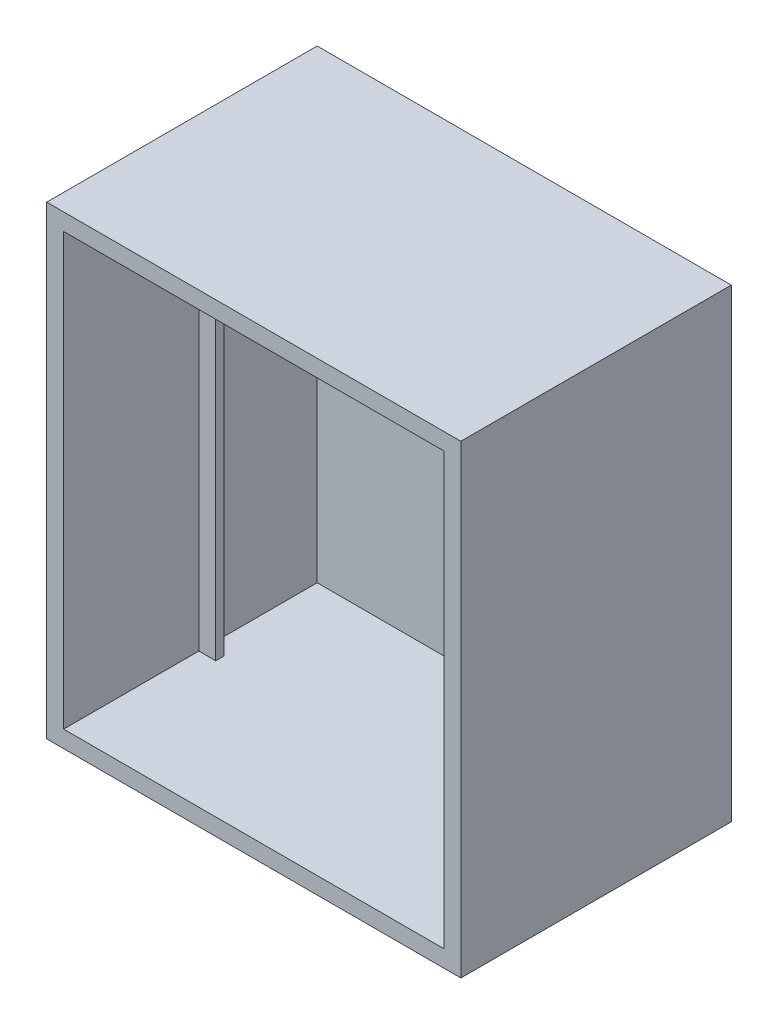
from build123d import *

# Parameters (mm, degrees)
SCHIZZO1_W                    = 49
SCHIZZO1_H                    = 55
ESTRUSIONE_ESTRUSIONE1_DEPTH  = 2
SCHIZZO3_W                    = 49
SCHIZZO3_H                    = 2
ESTRUSIONE_ESTRUSIONE2_DEPTH  = 30
SCHIZZO4_W                    = 2
SCHIZZO4_H                    = 53
ESTRUSIONE_ESTRUSIONE3_DEPTH  = 30
SCHIZZO5_W                    = 47
SCHIZZO5_H                    = 2
ESTRUSIONE_ESTRUSIONE4_DEPTH  = 30
SCHIZZO6_W                    = 2
SCHIZZO6_H                    = 51
ESTRUSIONE_ESTRUSIONE5_DEPTH  = 30
SCHIZZO7_W                    = 19
SCHIZZO7_H                    = 3
ESTRUSIONE_ESTRUSIONE6_DEPTH  = 13
SCHIZZO8_W                    = 1
SCHIZZO8_H                    = 44.7
ESTRUSIONE_ESTRUSIONE7_DEPTH  = 2
SCHIZZO10_W                   = 2
SCHIZZO10_H                   = 1
ESTRUSIONE_ESTRUSIONE8_DEPTH  = 7
SCHIZZO11_W                   = 17
SCHIZZO11_H                   = 3
ESTRUSIONE_ESTRUSIONE9_DEPTH  = 1
SCHIZZO12_W                   = 1
SCHIZZO12_H                   = 6.3
ESTRUSIONE_ESTRUSIONE10_DEPTH = 3
SCHIZZO14_W                   = 2
SCHIZZO14_H                   = 42.904744954
ESTRUSIONE_ESTRUSIONE12_DEPTH = 14
SCHIZZO17_W                   = 14
SCHIZZO17_H                   = 3
ESTRUSIONE_ESTRUSIONE14_DEPTH = 6
SCHIZZO18_W                   = 5
SCHIZZO18_H                   = 1.5
TAGLIO_ESTRUSIONE1_DEPTH      = 4
SCHIZZO20_W                   = 5
SCHIZZO20_H                   = 1
TAGLIO_ESTRUSIONE2_DEPTH      = 0.75
SCHIZZO21_W                   = 5
SCHIZZO21_H                   = 1
TAGLIO_ESTRUSIONE3_DEPTH      = 0.75
SCHIZZO22_W                   = 2
SCHIZZO22_H                   = 8.095255046
ESTRUSIONE_ESTRUSIONE15_DEPTH = 4
SCHIZZO24_W                   = 1
SCHIZZO24_H                   = 9.465960805
TAGLIO_ESTRUSIONE4_DEPTH      = 42.9


with BuildPart() as part:
    # Schizzo1 → Estrusione-Estrusione1 (new body)
    with BuildSketch(Plane.XY):
        with Locations((24.5, 27.5)):
            Rectangle(SCHIZZO1_W, SCHIZZO1_H)
    extrude(amount=ESTRUSIONE_ESTRUSIONE1_DEPTH)

    # Schizzo3 → Estrusione-Estrusione2 (add)
    with BuildSketch(Plane.XY.offset(2)):
        with Locations((24.5, 54)):
            Rectangle(SCHIZZO3_W, SCHIZZO3_H)
    extrude(amount=ESTRUSIONE_ESTRUSIONE2_DEPTH)

    # Schizzo4 → Estrusione-Estrusione3 (add)
    with BuildSketch(Plane.XY.offset(2)):
        with Locations((48, 26.5)):
            Rectangle(SCHIZZO4_W, SCHIZZO4_H)
    extrude(amount=ESTRUSIONE_ESTRUSIONE3_DEPTH)

    # Schizzo5 → Estrusione-Estrusione4 (add)
    with BuildSketch(Plane.XY.offset(2)):
        with Locations((23.5, 1)):
            Rectangle(SCHIZZO5_W, SCHIZZO5_H)
    extrude(amount=ESTRUSIONE_ESTRUSIONE4_DEPTH)

    # Schizzo6 → Estrusione-Estrusione5 (add)
    with BuildSketch(Plane.XY.offset(2)):
        with Locations((1, 27.5)):
            Rectangle(SCHIZZO6_W, SCHIZZO6_H)
    extrude(amount=ESTRUSIONE_ESTRUSIONE5_DEPTH)

    # Schizzo7 → Estrusione-Estrusione6 (add)
    with BuildSketch(Plane.XY.offset(2)):
        with Locations((11.5, 45.2)):
            Rectangle(SCHIZZO7_W, SCHIZZO7_H)
    extrude(amount=ESTRUSIONE_ESTRUSIONE6_DEPTH)

    # Schizzo8 → Estrusione-Estrusione7 (add)
    with BuildSketch(Plane(origin=(2, 0, 0), x_dir=(0, 0, -1), z_dir=(1, 0, 0))):
        with Locations((-15.5, 24.35)):
            Rectangle(SCHIZZO8_W, SCHIZZO8_H)
    extrude(amount=ESTRUSIONE_ESTRUSIONE7_DEPTH)

    # Schizzo10 → Estrusione-Estrusione8 (add)
    with BuildSketch(Plane(origin=(0, 46.7, 0), x_dir=(1, 0, 0), z_dir=(0, 1, 0))):
        with Locations((3, -15.5)):
            Rectangle(SCHIZZO10_W, SCHIZZO10_H)
    extrude(amount=ESTRUSIONE_ESTRUSIONE8_DEPTH)

    # Schizzo11 → Estrusione-Estrusione9 (add)
    with BuildSketch(Plane.XY.offset(15)):
        with Locations((12.5, 45.2)):
            Rectangle(SCHIZZO11_W, SCHIZZO11_H)
    extrude(amount=ESTRUSIONE_ESTRUSIONE9_DEPTH)

    # Schizzo12 → Estrusione-Estrusione10 (add)
    with BuildSketch(Plane(origin=(4, 0, 0), x_dir=(0, 0, -1), z_dir=(1, 0, 0))):
        with Locations((-15.5, 49.85)):
            Rectangle(SCHIZZO12_W, SCHIZZO12_H)
    extrude(amount=ESTRUSIONE_ESTRUSIONE10_DEPTH)

    # Schizzo14 → Estrusione-Estrusione12 (add)
    with BuildSketch(Plane.XY.offset(2)):
        with Locations((46, 23.452372477)):
            Rectangle(SCHIZZO14_W, SCHIZZO14_H)
    extrude(amount=ESTRUSIONE_ESTRUSIONE12_DEPTH)

    # Schizzo17 → Estrusione-Estrusione14 (add)
    with BuildSketch(Plane(origin=(21, 0, 0), x_dir=(0, 0, -1), z_dir=(1, 0, 0))):
        with Locations((-9, 45.2)):
            Rectangle(SCHIZZO17_W, SCHIZZO17_H)
    extrude(amount=ESTRUSIONE_ESTRUSIONE14_DEPTH)

    # Schizzo18 → Taglio-Estrusione1 (cut)
    with BuildSketch(Plane.XY.offset(16)):
        with Locations((22.5, 45.2)):
            Rectangle(SCHIZZO18_W, SCHIZZO18_H)
    extrude(amount=-TAGLIO_ESTRUSIONE1_DEPTH, mode=Mode.SUBTRACT)

    # Schizzo20 → Taglio-Estrusione2 (cut)
    with BuildSketch(Plane(origin=(0, 45.95, 0), x_dir=(-1, 0, 0), z_dir=(0, -1, 0))):
        with Locations((-22.5, -15.5)):
            Rectangle(SCHIZZO20_W, SCHIZZO20_H)
    extrude(amount=-TAGLIO_ESTRUSIONE2_DEPTH, mode=Mode.SUBTRACT)

    # Schizzo21 → Taglio-Estrusione3 (cut)
    with BuildSketch(Plane(origin=(0, 44.45, 0), x_dir=(1, 0, 0), z_dir=(0, 1, 0))):
        with Locations((22.5, -15.5)):
            Rectangle(SCHIZZO21_W, SCHIZZO21_H)
    extrude(amount=-TAGLIO_ESTRUSIONE3_DEPTH, mode=Mode.SUBTRACT)

    # Schizzo22 → Estrusione-Estrusione15 (add)
    with BuildSketch(Plane.ZY.offset(-47)):
        with Locations((15, 48.952372477)):
            Rectangle(SCHIZZO22_W, SCHIZZO22_H)
    extrude(amount=ESTRUSIONE_ESTRUSIONE15_DEPTH)

    # Schizzo24 → Taglio-Estrusione4 (cut)
    with BuildSketch(Plane(origin=(0, 44.904744954, 0), x_dir=(1, 0, 0), z_dir=(0, 1, 0))):
        with Locations((45.5, -7.82231618)):
            Rectangle(SCHIZZO24_W, SCHIZZO24_H)
    extrude(amount=-TAGLIO_ESTRUSIONE4_DEPTH, mode=Mode.SUBTRACT)


solid = part.part
